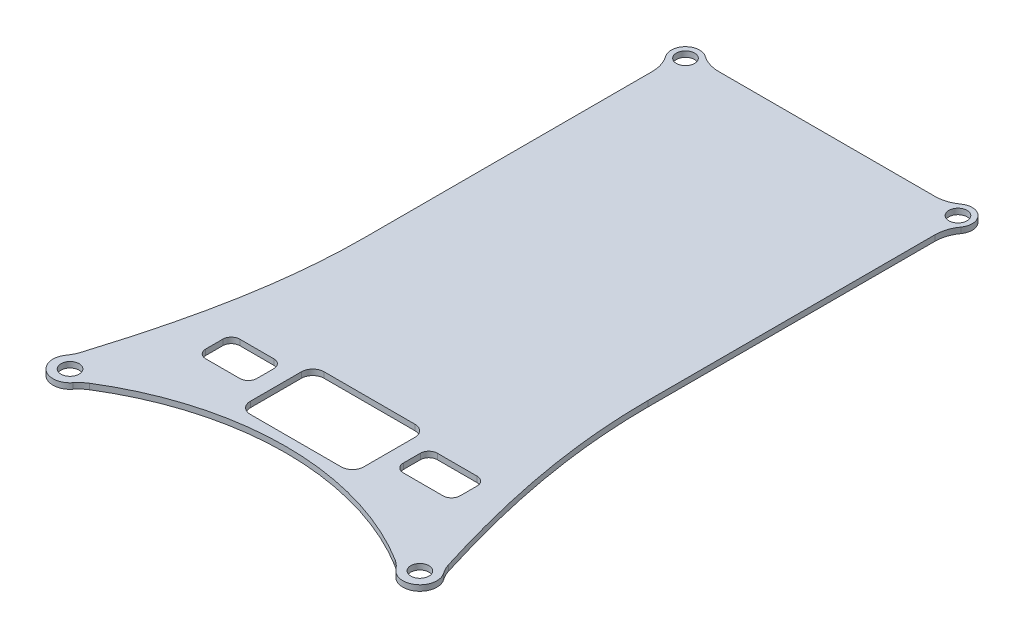
from build123d import *

# Parameters (mm, degrees)
COVER_MAIN_BOARD_1_START = 30
COVER_MAIN_BOARD_1_DEPTH = 1
SKETCH_2_R               = 2.5
SKETCH_2_R_2             = 3
EXTRUDE_1_DEPTH          = 1
FILLET_1_R               = 6
HOLE_WIZARD_M31_D        = 3.2
SKETCH_5_W               = 20
SKETCH_5_H               = 13
CUT_EXTRUDE_2_DEPTH      = 118.861812366
FILLET_2_R               = 2
SKETCH_7_W               = 10
SKETCH_7_H               = 4
SKETCH_7_W_2             = 9
CUT_EXTRUDE_4_DEPTH      = 118.861812366
FILLET_3_R               = 1.5
CUT_EXTRUDE_5_DEPTH      = 118.861812366


# Read off the part's stored shape, not the designer's step: Припуск-Cover_main_board-1
with BuildPart() as part:
    # Припуск-Cover_main_board-1 outline → Припуск-Cover_main_board-1 (new body)
    with BuildSketch(Plane(origin=(0, 0, 0), x_dir=(1, 0, 0), z_dir=(0, 1, 0)).offset(COVER_MAIN_BOARD_1_START)):
        with BuildLine():
            ThreePointArc((58.536662962, -97.610509717), (61.872887908, -97.542255565), (62.936422695, -94.379353532))
            add(Edge.make_bspline(
                [(62.936422695, -94.379353532), (61.798177223, -90.776493028), (60.72075986, -87.155811957), (58.774674414, -79.85329338), (57.908149184, -76.177190929), (56.466060339, -68.758031881), (55.893308454, -65.032046108), (55.109773151, -57.544971093), (54.899999704, -53.783069267), (54.9, -50)],
                knots=[0, 0, 0, 0, 0.25, 0.25, 0.5, 0.5, 0.75, 0.75, 1, 1, 1, 1], degree=3))
            Line((54.9, -50), (54.9, 6.4))
            Line((54.9, 6.4), (5.1, 6.4))
            Line((5.1, 6.4), (5.1, -50))
            add(Edge.make_bspline(
                [(5.1, -50), (5.099991031, -53.776486453), (4.890826579, -57.541590974), (4.10432522, -65.051764617), (3.53002006, -68.780548712), (2.088476888, -76.191600122), (1.222062078, -79.86132679), (-0.718312327, -87.143485068), (-1.7924779, -90.75713228), (-2.928662588, -94.354417399)],
                knots=[0, 0, 0, 0, 0.25, 0.25, 0.5, 0.5, 0.75, 0.75, 1, 1, 1, 1], degree=3))
            ThreePointArc((-2.928662588, -94.354417399), (-1.883263044, -97.534459074), (1.463338472, -97.610508751))
            ThreePointArc((1.463338472, -97.610508751), (30.000000864, -88.89999981), (58.536662962, -97.610509717))
        make_face()
    extrude(amount=COVER_MAIN_BOARD_1_DEPTH)

    # Эскиз2 → Бобышка-Вытянуть1 (add)
    with BuildSketch(Plane(origin=(0, 31, 0), x_dir=(1, 0, 0), z_dir=(0, 1, 0))):
        with Locations((6, 5.5)):
            Circle(SKETCH_2_R)
        with Locations((54, 5.5)):
            Circle(SKETCH_2_R)
        with Locations((-0.811267397, -96.088490424)):
            Circle(SKETCH_2_R_2)
        with Locations((60.811267397, -96.088490424)):
            Circle(SKETCH_2_R_2)
    extrude(amount=-EXTRUDE_1_DEPTH)

    # Скругление1
    fillet_1_edges = [part.edges().sort_by_distance(p)[0] for p in [
        (-2.75519034, 30.5, 93.803503862),
        (1.934506666, 30.5, 97.297094907),
        (58.065493335, 30.5, 97.297094908),
        (62.755023846, 30.5, 93.803362229),
        (54.9, 30.5, -3.167619242),
        (51.667619242, 30.5, -6.4),
        (8.332380758, 30.5, -6.4),
        (5.1, 30.5, -3.167619242),
    ]]
    fillet(fillet_1_edges, radius=FILLET_1_R)

    # Отверстие с зазором M31 (through all)
    with Locations(Plane(origin=(0, 31, 0), x_dir=(1, 0, 0), z_dir=(0, 1, 0))):
        with Locations((-0.811267397, -96.088490424), (60.811267397, -96.088490424), (54, 5.5), (6, 5.5)):
            Hole(HOLE_WIZARD_M31_D / 2)

    # Эскиз5 → Вырез-Вытянуть2 (cut, through all)
    with BuildSketch(Plane.XZ.offset(-30)):
        with Locations((30, 80.64999981)):
            Rectangle(SKETCH_5_W, SKETCH_5_H)
    extrude(amount=-CUT_EXTRUDE_2_DEPTH, mode=Mode.SUBTRACT)

    # Скругление2
    fillet_2_edges = [part.edges().sort_by_distance(p)[0] for p in [
        (40, 30.5, 87.14999981),
        (40, 30.5, 74.14999981),
        (20, 30.5, 74.14999981),
        (20, 30.5, 87.14999981),
    ]]
    fillet(fillet_2_edges, radius=FILLET_2_R)

    # Эскиз7 → Вырез-Вытянуть4 (cut, through all)
    with BuildSketch(Plane.XZ.offset(-30)):
        with Locations((47.9, 80.6)):
            Rectangle(SKETCH_7_W, SKETCH_7_H)
        with Locations((12.6, 80.6)):
            Rectangle(SKETCH_7_W_2, SKETCH_7_H)
    extrude(amount=-CUT_EXTRUDE_4_DEPTH, mode=Mode.SUBTRACT)

    # Скругление3
    fillet_3_edges = [part.edges().sort_by_distance(p)[0] for p in [
        (42.9, 30.5, 78.6),
        (42.9, 30.5, 82.6),
        (52.9, 30.5, 82.6),
        (52.9, 30.5, 78.6),
        (17.1, 30.5, 82.6),
        (17.1, 30.5, 78.6),
        (8.1, 30.5, 78.6),
        (8.1, 30.5, 82.6),
    ]]
    fillet(fillet_3_edges, radius=FILLET_3_R)

    # Эскиз10 → Вырез-Вытянуть5 (cut, through all)
    with BuildSketch(Plane(origin=(0, 31, 0), x_dir=(1, 0, 0), z_dir=(0, 1, 0))):
        with BuildLine():
            Line((42.9, -80.1), (52.9, -80.1))
            Line((52.9, -80.1), (52.9, -78.1))
            ThreePointArc((52.9, -78.1), (52.460660172, -77.039339828), (51.4, -76.6))
            Line((51.4, -76.6), (44.4, -76.6))
            ThreePointArc((44.4, -76.6), (43.339339828, -77.039339828), (42.9, -78.1))
            Line((42.9, -78.1), (42.9, -80.1))
        make_face()
        with BuildLine():
            Line((8.1, -80.1), (17.1, -80.1))
            Line((17.1, -80.1), (17.1, -78.1))
            ThreePointArc((17.1, -78.1), (16.660660172, -77.039339828), (15.6, -76.6))
            Line((15.6, -76.6), (9.6, -76.6))
            ThreePointArc((9.6, -76.6), (8.539339828, -77.039339828), (8.1, -78.1))
            Line((8.1, -78.1), (8.1, -80.1))
        make_face()
    extrude(amount=-CUT_EXTRUDE_5_DEPTH, mode=Mode.SUBTRACT)


solid = part.part
